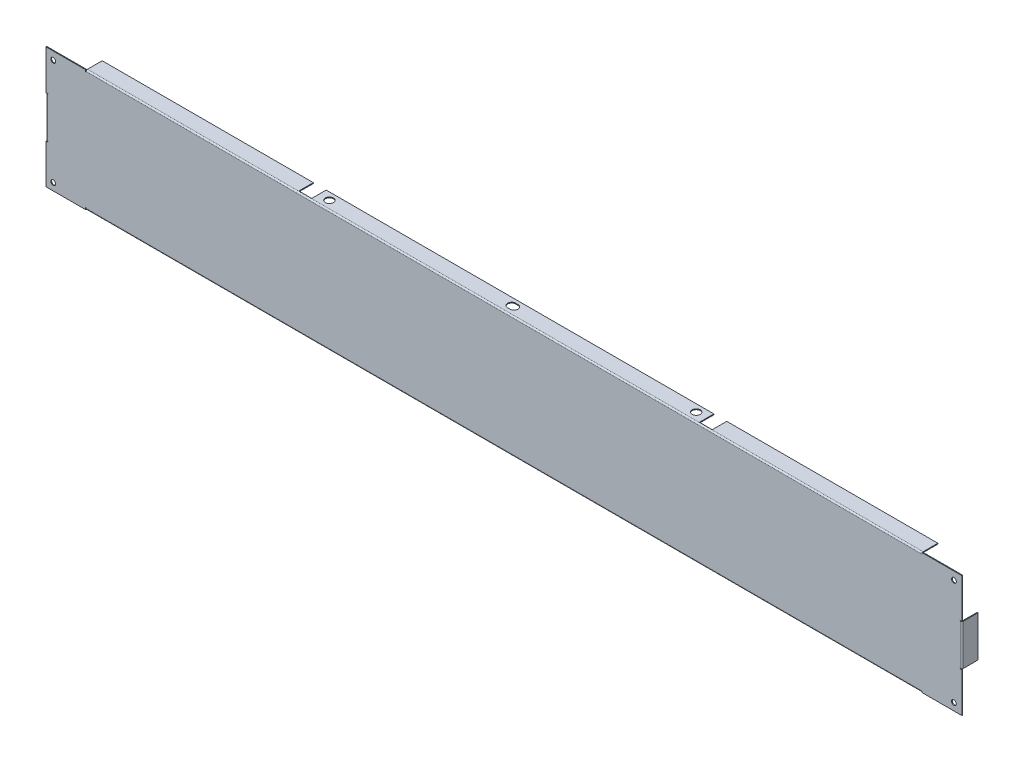
from build123d import *

# Parameters (mm, degrees)
SKETCH_1_W                        = 1141
SKETCH_1_H                        = 151
SM_BASE_FLANGE_1_DEPTH            = 1
SM_EDGE_FLANGE_1_STRIP_W          = 5.4732
SM_EDGE_FLANGE_1_STRIP_H          = 1
SM_EDGE_FLANGE_1_STRIP_CUT_DEPTH  = 51
SM_EDGE_FLANGE_1_RELIEF_W         = 5.9732
SM_EDGE_FLANGE_1_RELIEF_H         = 0.5
SM_EDGE_FLANGE_1_RELIEF_CUT_DEPTH = 1
SM_EDGE_FLANGE_1_DEPTH            = 51
SM_EDGE_FLANGE_2_STRIP_W          = 5.4732
SM_EDGE_FLANGE_2_STRIP_H          = 1
SM_EDGE_FLANGE_2_STRIP_CUT_DEPTH  = 1041
SM_EDGE_FLANGE_2_RELIEF_W         = 5.9732
SM_EDGE_FLANGE_2_RELIEF_H         = 0.5
SM_EDGE_FLANGE_2_RELIEF_CUT_DEPTH = 1
SM_EDGE_FLANGE_2_DEPTH            = 1041
SM_EDGE_FLANGE_2_FLAT_DEPTH       = 1
SM_EDGE_FLANGE_4_STRIP_W          = 5.4732
SM_EDGE_FLANGE_4_STRIP_H          = 1
SM_EDGE_FLANGE_4_STRIP_CUT_DEPTH  = 51
SM_EDGE_FLANGE_4_RELIEF_W         = 5.9732
SM_EDGE_FLANGE_4_RELIEF_H         = 0.5
SM_EDGE_FLANGE_4_RELIEF_CUT_DEPTH = 1
SM_EDGE_FLANGE_4_DEPTH            = 51
SKETCH_15_R                       = 5
CUT_EXTRUDE_1_DEPTH               = 591.48391172
SKETCH_16_R                       = 3
CUT_EXTRUDE_2_DEPTH               = 576.7877213


# Sheet-metal steps are written as plain solids
with BuildPart() as part:
    # Sketch 1 → 基体-法兰1 (new body)
    with BuildSketch(Plane.XY):
        Rectangle(SKETCH_1_W, SKETCH_1_H)
    extrude(amount=-SM_BASE_FLANGE_1_DEPTH)

    # 边线-法兰1 strip (across the edge) → 边线-法兰1 strip cut (cut)
    with BuildSketch(Plane(origin=(570.5, 25.5, -1), x_dir=(-1, 0, 0), z_dir=(0, -1, 0))):
        with Locations((-1, -0.5)):
            Rectangle(SM_EDGE_FLANGE_1_STRIP_W, SM_EDGE_FLANGE_1_STRIP_H)
    extrude(amount=SM_EDGE_FLANGE_1_STRIP_CUT_DEPTH, mode=Mode.SUBTRACT)

    # 边线-法兰1 relief (on the sheet) → 边线-法兰1 relief cut (cut)
    with BuildSketch(Plane(origin=(568.7634, 25.5, -1), x_dir=(-1, 0, 0), z_dir=(0, 0, -1))):
        with Locations((-2.4866, 0.25)):
            Rectangle(SM_EDGE_FLANGE_1_RELIEF_W, SM_EDGE_FLANGE_1_RELIEF_H)
        with Locations((-2.4866, -51.25)):
            Rectangle(SM_EDGE_FLANGE_1_RELIEF_W, SM_EDGE_FLANGE_1_RELIEF_H)
    extrude(amount=-SM_EDGE_FLANGE_1_RELIEF_CUT_DEPTH, mode=Mode.SUBTRACT)

    # 边线-法兰1 section (across the edge) → 边线-法兰1 (add)
    with BuildSketch(Plane(origin=(570.5, 25.5, -1), x_dir=(-1, 0, 0), z_dir=(0, -1, 0))):
        with BuildLine():
            Line((0, 0.7366), (0, 19))
            Line((0, 19), (1, 19))
            Line((1, 19), (1, 0.7366))
            ThreePointArc((1, 0.7366), (1.215745145, 0.215745145), (1.7366, 0))
            Line((1.7366, 0), (1.7366, -1))
            ThreePointArc((1.7366, -1), (0.508638364, -0.491361636), (0, 0.7366))
        make_face()
    extrude(amount=SM_EDGE_FLANGE_1_DEPTH)

    # 边线-法兰2 strip (across the edge) → 边线-法兰2 strip cut (cut)
    with BuildSketch(Plane(origin=(-520.5, 75.5, -1), x_dir=(0, -1, 0), z_dir=(1, 0, 0))):
        with Locations((-1, -0.5)):
            Rectangle(SM_EDGE_FLANGE_2_STRIP_W, SM_EDGE_FLANGE_2_STRIP_H)
    sm_edge_flange_2_strip_cut = extrude(amount=SM_EDGE_FLANGE_2_STRIP_CUT_DEPTH, mode=Mode.SUBTRACT)

    # 边线-法兰2 relief (on the sheet) → 边线-法兰2 relief cut (cut)
    with BuildSketch(Plane(origin=(-520.5, 73.7634, -1), x_dir=(0, -1, 0), z_dir=(0, 0, -1))):
        with Locations((-2.4866, 0.25)):
            Rectangle(SM_EDGE_FLANGE_2_RELIEF_W, SM_EDGE_FLANGE_2_RELIEF_H)
        with Locations((-2.4866, -1041.25)):
            Rectangle(SM_EDGE_FLANGE_2_RELIEF_W, SM_EDGE_FLANGE_2_RELIEF_H)
    sm_edge_flange_2_relief_cut = extrude(amount=-SM_EDGE_FLANGE_2_RELIEF_CUT_DEPTH, mode=Mode.SUBTRACT)

    # 边线-法兰2 bend section (across the edge) → 边线-法兰2 (add)
    with BuildSketch(Plane(origin=(-520.5, 75.5, -1), x_dir=(0, -1, 0), z_dir=(1, 0, 0))):
        with BuildLine():
            Line((0, 0.7366), (1, 0.7366))
            ThreePointArc((1, 0.7366), (1.215745145, 0.215745145), (1.7366, 0))
            Line((1.7366, 0), (1.7366, -1))
            ThreePointArc((1.7366, -1), (0.508638364, -0.491361636), (0, 0.7366))
        make_face()
    sm_edge_flange_2 = extrude(amount=SM_EDGE_FLANGE_2_DEPTH)

    # 边线-法兰2 profile (on flange) → 边线-法兰2 flat (add)
    with BuildSketch(Plane(origin=(0, 75.5, -1), x_dir=(1, 0, 0), z_dir=(0, 1, 0))):
        Polygon((520.5, 0.7366), (520.5, 19), (257.5, 19), (257.5, 1), (241.5, 1), (241.5, 19), (-241.5, 19), (-241.5, 1), (-257.5, 1), (-257.5, 19), (-520.5, 19), (-520.5, 0.7366), align=None)
    sm_edge_flange_2_flat = extrude(amount=-SM_EDGE_FLANGE_2_FLAT_DEPTH)

    # 边线-法兰4 strip (across the edge) → 边线-法兰4 strip cut (cut)
    with BuildSketch(Plane(origin=(-570.5, -25.5, -1), x_dir=(1, 0, 0), z_dir=(0, 1, 0))):
        with Locations((-1, -0.5)):
            Rectangle(SM_EDGE_FLANGE_4_STRIP_W, SM_EDGE_FLANGE_4_STRIP_H)
    extrude(amount=SM_EDGE_FLANGE_4_STRIP_CUT_DEPTH, mode=Mode.SUBTRACT)

    # 边线-法兰4 relief (on the sheet) → 边线-法兰4 relief cut (cut)
    with BuildSketch(Plane(origin=(-568.7634, -25.5, -1), x_dir=(1, 0, 0), z_dir=(0, 0, -1))):
        with Locations((-2.4866, 0.25)):
            Rectangle(SM_EDGE_FLANGE_4_RELIEF_W, SM_EDGE_FLANGE_4_RELIEF_H)
        with Locations((-2.4866, -51.25)):
            Rectangle(SM_EDGE_FLANGE_4_RELIEF_W, SM_EDGE_FLANGE_4_RELIEF_H)
    extrude(amount=-SM_EDGE_FLANGE_4_RELIEF_CUT_DEPTH, mode=Mode.SUBTRACT)

    # 边线-法兰4 section (across the edge) → 边线-法兰4 (add)
    with BuildSketch(Plane(origin=(-570.5, -25.5, -1), x_dir=(1, 0, 0), z_dir=(0, 1, 0))):
        with BuildLine():
            Line((0, 0.7366), (0, 19))
            Line((0, 19), (1, 19))
            Line((1, 19), (1, 0.7366))
            ThreePointArc((1, 0.7366), (1.215745145, 0.215745145), (1.7366, 0))
            Line((1.7366, 0), (1.7366, -1))
            ThreePointArc((1.7366, -1), (0.508638364, -0.491361636), (0, 0.7366))
        make_face()
    extrude(amount=SM_EDGE_FLANGE_4_DEPTH)

    # 镜向1: 边线-法兰2 strip cut, 边线-法兰2 relief cut, 边线-法兰2, 边线-法兰2 flat across plane
    add(sm_edge_flange_2_strip_cut.mirror(Plane.ZX), mode=Mode.SUBTRACT)
    add(sm_edge_flange_2_relief_cut.mirror(Plane.ZX), mode=Mode.SUBTRACT)
    add(sm_edge_flange_2.mirror(Plane.ZX))
    add(sm_edge_flange_2_flat.mirror(Plane.ZX))

    # 草图15 → 切除-拉伸1 (cut, through all)
    with BuildSketch(Plane(origin=(0, 75.5, 0), x_dir=(1, 0, 0), z_dir=(0, 1, 0))):
        with Locations(Location((-228.5, 11, 0), (0, 0, 270))):
            Circle(SKETCH_15_R)
        with Locations(Location((228.5, 11, 0), (0, 0, 270))):
            Circle(SKETCH_15_R)
        with BuildLine():
            Line((-1.5, 16), (1.5, 16))
            ThreePointArc((1.5, 16), (6.5, 11), (1.5, 6))
            Line((1.5, 6), (-1.5, 6))
            ThreePointArc((-1.5, 6), (-6.5, 11), (-1.5, 16))
        make_face()
    extrude(amount=-CUT_EXTRUDE_1_DEPTH, mode=Mode.SUBTRACT)

    # 草图16 → 切除-拉伸2 (cut, through all)
    with BuildSketch(Plane(origin=(0, 0, -1), x_dir=(-1, 0, 0), z_dir=(0, 0, -1))):
        with Locations((-560.5, -66.5)):
            Circle(SKETCH_16_R)
        with Locations((-560.5, 65.5)):
            Circle(SKETCH_16_R)
        with Locations((561.5, -66.5)):
            Circle(SKETCH_16_R)
        with Locations((561.5, 65.5)):
            Circle(SKETCH_16_R)
    extrude(amount=-CUT_EXTRUDE_2_DEPTH, mode=Mode.SUBTRACT)


solid = part.part
